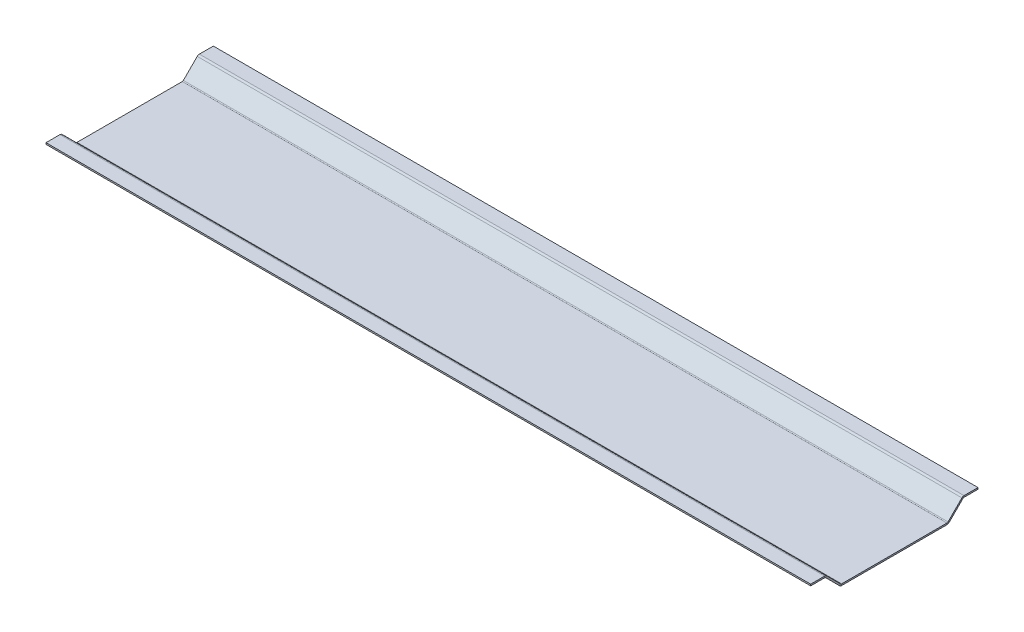
from build123d import *

# Parameters (mm, degrees)
SM_BASE_FLANGE_1_DEPTH = 377


# Sheet-metal steps are written as plain solids
with BuildPart() as part:
    # Sketch 1 → Базовая кромка1 (new body)
    with BuildSketch(Plane(origin=(0, 0, 0), x_dir=(0, 0, -1), z_dir=(1, 0, 0))):
        with BuildLine():
            Line((0, -15), (-51.878679656, -15))
            ThreePointArc((-51.878679656, -15), (-52.452704805, -14.885819299), (-52.939339828, -14.560660172))
            Line((-52.939339828, -14.560660172), (-66.621320344, -0.878679656))
            ThreePointArc((-66.621320344, -0.878679656), (-67.59459039, -0.228361402), (-68.742640687, 0))
            Line((-68.742640687, 0), (-82.5, 0))
            Line((-82.5, 0), (-82.5, -1.5))
            Line((-82.5, -1.5), (-68.742640687, -1.5))
            ThreePointArc((-68.742640687, -1.5), (-68.168615539, -1.614180701), (-67.681980515, -1.939339828))
            Line((-67.681980515, -1.939339828), (-54, -15.621320344))
            ThreePointArc((-54, -15.621320344), (-53.026729954, -16.271638598), (-51.878679656, -16.5))
            Line((-51.878679656, -16.5), (0, -16.5))
            Line((0, -16.5), (0, -15))
        make_face()
    extrude(amount=-SM_BASE_FLANGE_1_DEPTH)

    # Зеркальное отражение1: part across plane


with BuildPart() as part_1:
    add(part.part)
    add(part.part.mirror(Plane(origin=(-494.133821974, -15, 0), x_dir=(1, 0, 0), z_dir=(0, 0, 1))))

    # Зеркальное отражение2: part across plane


with BuildPart() as part_2:
    add(part_1.part)
    add(part_1.part.mirror(Plane(origin=(0, -15.621320344, 54), x_dir=(0, 0, 1), z_dir=(1, 0, 0))))


solid = part_2.part
